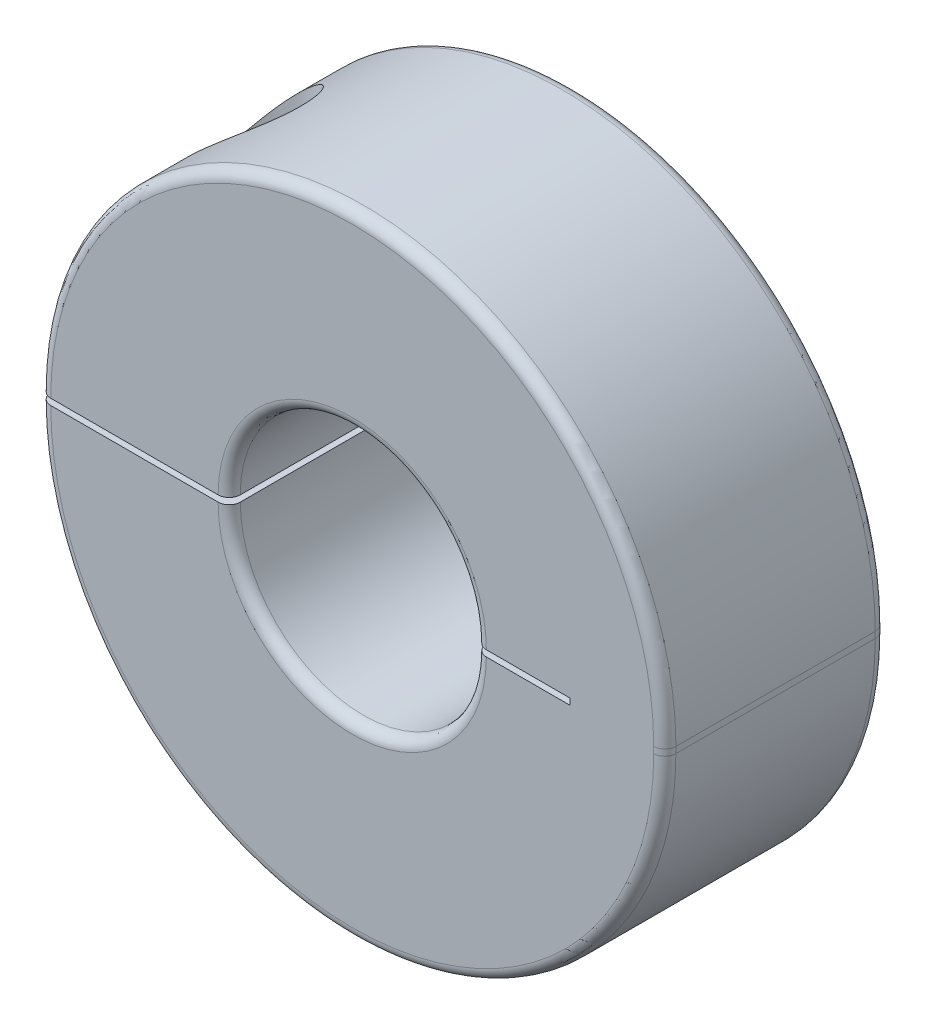
from build123d import *

# Parameters (mm, degrees)
EXTRUDE1_DEPTH     = 4.5
CUT_EXTRUDE2_DEPTH = 1.5
FILLET1_R          = 0.45
FILLET2_R          = 0.45
CHAMFER2_SIZE      = 0.254


with BuildPart() as part:
    # Sketch1 → Extrude1 (new, symmetric)
    with BuildSketch(Plane.XY):
        with BuildLine():
            Line((-12.7, 0.127), (-5, 0.127))
            ThreePointArc((-5, 0.127), (0, 5.127), (5, 0.127))
            Line((5, 0.127), (8.85, 0.127))
            Line((8.85, 0.127), (8.85, -0.127))
            Line((8.85, -0.127), (5, -0.127))
            ThreePointArc((5, -0.127), (0, -5.127), (-5, -0.127))
            Line((-5, -0.127), (-12.7, -0.127))
            ThreePointArc((-12.7, -0.127), (0, -12.827), (12.7, -0.127))
            Line((12.7, -0.127), (12.7, 0.127))
            ThreePointArc((12.7, 0.127), (0, 12.827), (-12.7, 0.127))
        make_face()
    extrude(amount=EXTRUDE1_DEPTH, both=True)

    # Sketch4 → Cut-Revolve1 (revolve, cut)
    with BuildSketch(Plane.XY):
        Polygon((-8.85, 12.827), (-6.6, 12.827), (-6.6, 1.627), (-7.35, 1.627), (-7.35, -12.827), (-8.85, -12.827), align=None)
    revolve(axis=Axis((-8.85, -12.827, 0), (0, 1, 0)), mode=Mode.SUBTRACT)

    # Fillet1
    fillet1_edges = [part.edges().sort_by_distance(p)[0] for p in [
        (0, 5.127, -4.5),
        (0, 5.127, 4.5),
        (0, 12.827, -4.5),
        (0, 12.827, 4.5),
        (0, -12.827, -4.5),
        (0, -12.827, 4.5),
        (12.7, 0, -4.5),
        (12.7, 0, 4.5),
    ]]
    fillet(fillet1_edges, radius=FILLET1_R)

    # Fillet2
    fillet2_edges = [part.edges().sort_by_distance(p)[0] for p in [
        (0, -5.127, -4.5),
        (0, -5.127, 4.5),
    ]]
    fillet(fillet2_edges, radius=FILLET2_R)


with BuildPart() as body_2:
    # Sketch6 → Revolve1 (revolve)
    with BuildSketch(Plane.XY):
        Polygon((-8.85, 4.627), (-6.6, 4.627), (-6.6, 1.627), (-7.35, 1.627), (-7.35, -4.373), (-8.85, -4.373), align=None)
    revolve(axis=Axis((-8.85, -4.373, 0), (0, 1, 0)))

    # Sketch7 → Cut-Extrude2 (cut)
    with BuildSketch(Plane(origin=(0, 4.627, 0), x_dir=(-1, 0, 0), z_dir=(0, 1, 0))):
        Polygon((8.85, -1.385640646), (10.05, -0.692820323), (10.05, 0.692820323), (8.85, 1.385640646), (7.65, 0.692820323), (7.65, -0.692820323), align=None)
    extrude(amount=-CUT_EXTRUDE2_DEPTH, mode=Mode.SUBTRACT)

    # Chamfer2
    chamfer2_edges = [body_2.edges().sort_by_distance(p)[0] for p in [
        (-11.1, 4.627, 0),
    ]]
    chamfer(chamfer2_edges, length=CHAMFER2_SIZE)


solid = Compound([part.part, body_2.part])
